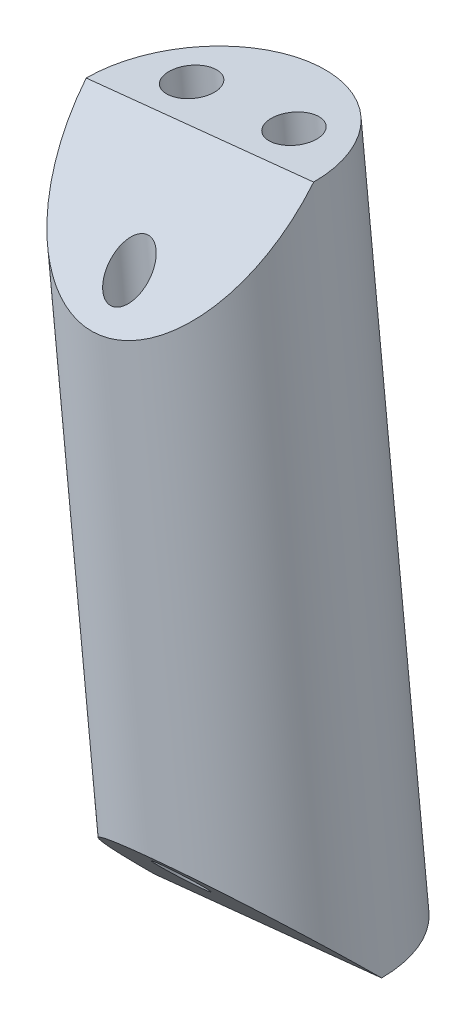
from build123d import *

# Parameters (mm, degrees)
SKETCH3_R               = 8
BOSS_EXTRUDE1_DEPTH     = 46.103684211
CUT_EXTRUDE1_DEPTH      = 200.187264303
CUT_EXTRUDE1_DEPTH_BACK = 200.187264303
CUT_EXTRUDE3_DEPTH      = 52.740532935
CUT_EXTRUDE3_DEPTH_BACK = 52.740532935
SKETCH8_R               = 1.4
SKETCH8_R_2             = 1.6


with BuildPart() as part:
    # Sketch3 → Boss-Extrude1 (new body)
    with BuildSketch(Plane(origin=(-20.344467381, 196.178792599, 0), x_dir=(-0.9946657577296572, -0.10315052302381678, 0), z_dir=(0.10315052302381678, -0.9946657577296572, 0))):
        with Locations((-10.431405186, 0)):
            Circle(SKETCH3_R)
    extrude(amount=BOSS_EXTRUDE1_DEPTH)

    # Sketch4 → Cut-Extrude1 (cut, two sides: drawn at the far end of the back side and taken through both)
    with BuildSketch(Plane(origin=(10.375761543, 1.076004901, 0), x_dir=(0.10315052302381672, -0.9946657577296572, 0), z_dir=(-0.9946657577296572, -0.10315052302381673, 0)).offset(-CUT_EXTRUDE1_DEPTH_BACK)):
        Polygon((-197.230869842, 0), (-189.230869842, 8), (-197.230869842, 8), align=None)
        Polygon((-159.127185631, 8), (-151.127185631, 8), (-151.127185631, 0), align=None)
    extrude(amount=CUT_EXTRUDE1_DEPTH + CUT_EXTRUDE1_DEPTH_BACK, mode=Mode.SUBTRACT)

    # Sketch8 → Cut-Extrude3 (cut, two sides: drawn at the far end of the back side and taken through both)
    with BuildSketch(Plane(origin=(-20.344467381, 196.178792599, 0), x_dir=(0.9946657577296572, 0.10315052302381678, 0), z_dir=(-0.10315052302381678, 0.9946657577296572, 0)).offset(-CUT_EXTRUDE3_DEPTH_BACK)):
        with Locations((10.431405186, -5.5)):
            Circle(SKETCH8_R)
        with Locations((6.831405186, 3)):
            Circle(SKETCH8_R_2)
        with Locations((14.031405186, 3)):
            Circle(SKETCH8_R_2)
    extrude(amount=CUT_EXTRUDE3_DEPTH + CUT_EXTRUDE3_DEPTH_BACK, mode=Mode.SUBTRACT)


solid = part.part
